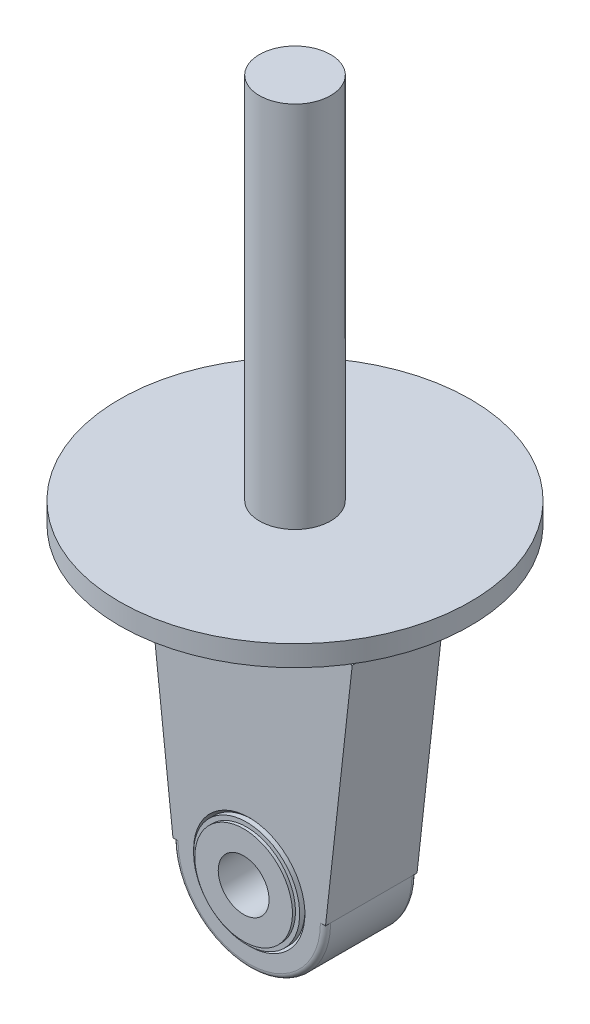
from build123d import *

# Parameters (mm, degrees)
EXTRUDE1_REACH             = 25.495
EXTRUDE1_DIRECTION_2_REACH = 25.495


with BuildPart() as part:
    # Sketch2 → Revolve1 (revolve)
    with BuildSketch(Plane(origin=(0, 0, 0), x_dir=(1, 0, 0), z_dir=(0, 1, 0))):
        with BuildLine():
            Line((5, 10.1), (5, -10.1))
            Line((5, -10.1), (9.6, -10.1))
            Line((9.6, -10.1), (9.6, -9.510239904))
            Line((9.6, -9.510239904), (10.433077185, -9.510239904))
            Line((10.433077185, -9.510239904), (10.433077185, -8.48743323))
            Line((10.433077185, -8.48743323), (10.945643955, -9))
            Line((10.945643955, -9), (14, -9))
            ThreePointArc((14, -9), (14.707106781, -8.707106781), (15, -8))
            Line((15, -8), (15, 8))
            ThreePointArc((15, 8), (14.707106781, 8.707106781), (14, 9))
            Line((14, 9), (10.945643955, 9))
            Line((10.945643955, 9), (10.433077185, 8.48743323))
            Line((10.433077185, 8.48743323), (10.433077185, 9.510239904))
            Line((10.433077185, 9.510239904), (9.6, 9.510239904))
            Line((9.6, 9.510239904), (9.6, 10.1))
            Line((9.6, 10.1), (5, 10.1))
        make_face()
    revolve(axis=Axis((0, 0, -9.945393457), (0, 0, 1)))

    # Extrude1: up to this face of the body (flat: up to its plane)
    extrude1_end = Plane(part.part.faces().sort_by_distance((-11.341623752, 0, 9))[0])
    # Sketch3 → Extrude1 (add, up to the picked face)
    with BuildSketch(Plane.XY, mode=Mode.PRIVATE) as extrude1_sk1:
        with BuildLine():
            Line((-20.25, 47), (-15, 0))
            Line((-15, 0), (-10.945643955, 0))
            ThreePointArc((-10.945643955, 0), (0, 10.945643955), (10.945643955, 0))
            Line((10.945643955, 0), (15, 0))
            Line((15, 0), (20.25, 47))
            Line((20.25, 47), (-20.25, 47))
        make_face()
    extrude1_tool1 = split(extrude(extrude1_sk1.sketch, amount=EXTRUDE1_REACH, mode=Mode.PRIVATE), bisect_by=extrude1_end, keep=Keep.BOTH, mode=Mode.PRIVATE)
    add(extrude1_tool1.solids().sort_by(Axis((0, 27.232341, 0), (0, 0, 1)))[0])

    # Extrude1 direction 2: up to this face of the body (flat: up to its plane)
    extrude1_direction_2_end = Plane(part.part.faces().sort_by_distance((-13.604020203, 0, -9))[0])
    # Sketch3 → Extrude1 direction 2 (add, up to the picked face)
    with BuildSketch(Plane.XY, mode=Mode.PRIVATE) as extrude1_direction_2_sk1:
        with BuildLine():
            Line((-20.25, 47), (-15, 0))
            Line((-15, 0), (-10.945643955, 0))
            ThreePointArc((-10.945643955, 0), (0, 10.945643955), (10.945643955, 0))
            Line((10.945643955, 0), (15, 0))
            Line((15, 0), (20.25, 47))
            Line((20.25, 47), (-20.25, 47))
        make_face()
    extrude1_direction_2_tool1 = split(extrude(extrude1_direction_2_sk1.sketch, amount=-EXTRUDE1_DIRECTION_2_REACH, mode=Mode.PRIVATE), bisect_by=extrude1_direction_2_end, keep=Keep.BOTH, mode=Mode.PRIVATE)
    add(extrude1_direction_2_tool1.solids().sort_by(Axis((0, 27.232341, 0), (0, 0, -1)))[0])

    # Sketch7 → Revolve2 (revolve)
    with BuildSketch(Plane.XY):
        Polygon((0, 47), (20.25, 47), (20.25, 53.100825313), (34.5, 56.36235646), (34.5, 60.45), (7, 60.45), (7, 132.908961398), (0, 132.908961398), align=None)
    revolve(axis=Axis((0, 0, 0), (0, 1, 0)))


solid = part.part
